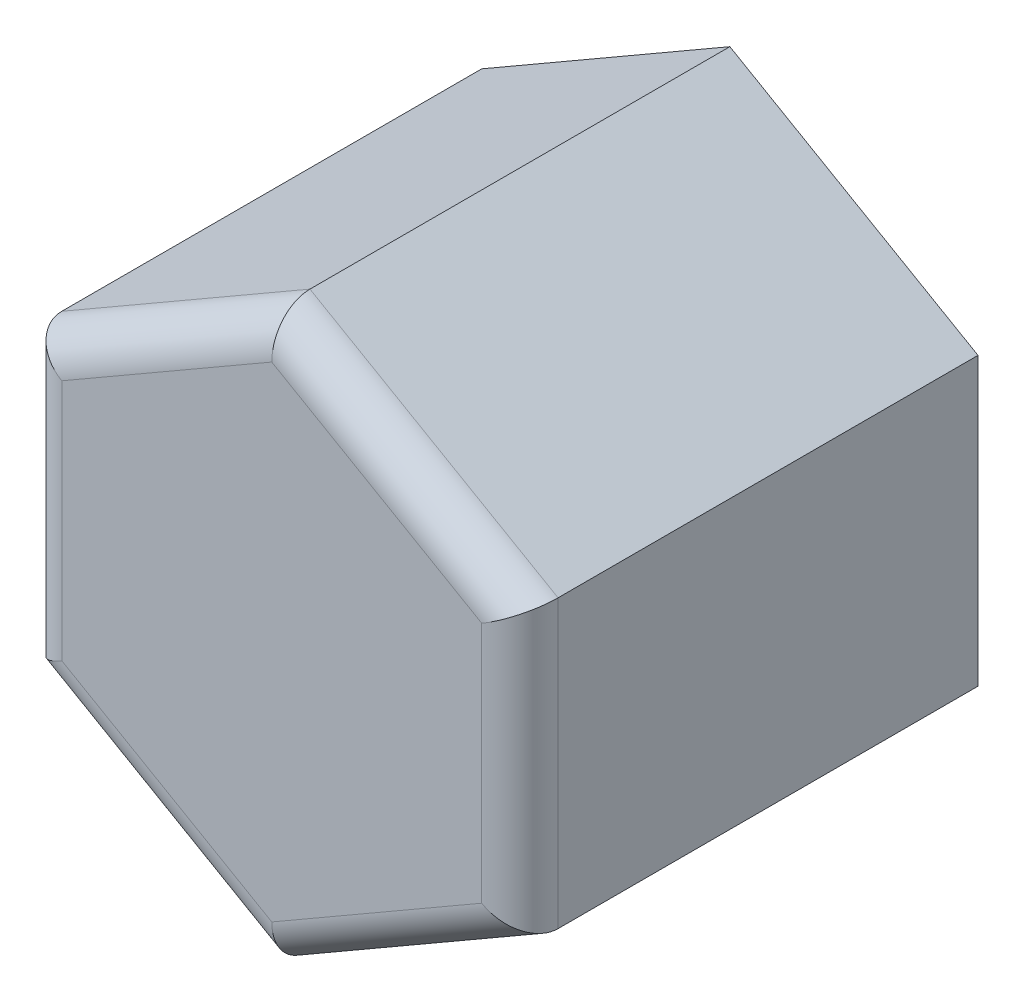
from build123d import *

# Parameters (mm, degrees)
EXTRUDE_276_DEPTH     = 6
SKETCH_3_R            = 4
CUT_EXTRUDE_451_DEPTH = 9.7
THREAD_2_PITCH        = 1.25
FILLET_1_R            = 1


with BuildPart() as part:
    # Эскиз1 → Extrude 276 (new, symmetric)
    with BuildSketch(Plane.XY):
        Polygon((0, 7.505553499), (-6.5, 3.75277675), (-6.5, -3.75277675), (0, -7.505553499), (6.5, -3.75277675), (6.5, 3.75277675), align=None)
    extrude(amount=EXTRUDE_276_DEPTH, both=True)

    # Эскиз3 → Cut-Extrude 451 (cut)
    with BuildSketch(Plane(origin=(0, 0, -6), x_dir=(-1, 0, 0), z_dir=(0, 0, -1))):
        Circle(SKETCH_3_R)
    extrude(amount=-CUT_EXTRUDE_451_DEPTH, mode=Mode.SUBTRACT)

    # Резьба2: the profile of Профиль резьбы2 profile screwed along a right-hand helix of 7.76 turns, 8 arcs to a turn; built about Z, then put on its axis
    thread_2_z = Axis((0, 0, 0), (0, 0, 1))
    thread_2_corners = [(4.0003, 0, -0.000173205), (3.323417656, 0, 0.390624998), (3.323417656, 0, 0.546874998), (4.0003, 0, 0.937673202)]
    with BuildLine(mode=Mode.PRIVATE) as thread_2_profile:
        Line(thread_2_corners[0], thread_2_corners[1])
        Line(thread_2_corners[1], thread_2_corners[2])
        Line(thread_2_corners[2], thread_2_corners[3])
        Line(thread_2_corners[3], thread_2_corners[0])
    thread_2_cap = Face(thread_2_profile.wire())
    thread_2_turn_angles = [0, 22.5, 45, 67.5, 90, 112.5, 135, 157.5, 180, 202.5, 225, 247.5, 270, 292.5, 315, 337.5, 360]
    thread_2_turn_weights = [1, 0.9238795325112867, 1, 0.9238795325112867, 1, 0.9238795325112867, 1, 0.9238795325112867, 1, 0.9238795325112867, 1, 0.9238795325112867, 1, 0.9238795325112867, 1, 0.9238795325112867, 1]
    thread_2_turn_rails = [Edge.make_bspline([Vector(p[0], p[1], 0).rotate(thread_2_z, thread_2_turn_angles[k]) / thread_2_turn_weights[k] + Vector(0, 0, p[2] + THREAD_2_PITCH * thread_2_turn_angles[k] / 360) for k in range(17)], [0, 0, 0, 1, 1, 2, 2, 3, 3, 4, 4, 5, 5, 6, 6, 7, 7, 8, 8, 8], 2, thread_2_turn_weights) for p in thread_2_corners]
    thread_2_turn_sides = [Face.make_surface_from_curves(thread_2_turn_rails[p[0]], thread_2_turn_rails[p[1]]) for p in [(0, 1), (1, 2), (2, 3), (3, 0)]]
    thread_2_last_angles = [2520, 2542.5, 2565, 2587.5, 2610, 2632.5, 2655, 2677.5, 2700, 2722.5, 2745, 2767.5, 2790, 2791.8, 2793.6]
    thread_2_last_weights = [1, 0.9238795325112867, 1, 0.9238795325112867, 1, 0.9238795325112867, 1, 0.9238795325112867, 1, 0.9238795325112867, 1, 0.9238795325112867, 1, 0.9995065603657317, 1]
    thread_2_last_rails = [Edge.make_bspline([Vector(p[0], p[1], 0).rotate(thread_2_z, thread_2_last_angles[k]) / thread_2_last_weights[k] + Vector(0, 0, p[2] + THREAD_2_PITCH * thread_2_last_angles[k] / 360) for k in range(15)], [0, 0, 0, 1, 1, 2, 2, 3, 3, 4, 4, 5, 5, 6, 6, 7, 7, 7], 2, thread_2_last_weights) for p in thread_2_corners]
    thread_2_last_sides = [Face.make_surface_from_curves(thread_2_last_rails[p[0]], thread_2_last_rails[p[1]]) for p in [(0, 1), (1, 2), (2, 3), (3, 0)]]
    thread_2 = Plane(origin=(0, 0, -6), x_dir=(1, 0, 0), z_dir=(0, 0, 1)) * Solid(Shell([*[p.moved(Location((0, 0, THREAD_2_PITCH * i))) for i in range(7) for p in thread_2_turn_sides], *thread_2_last_sides, thread_2_cap, thread_2_cap.rotate(thread_2_z, 2793.6).moved(Location((0, 0, THREAD_2_PITCH * 2793.6 / 360)))]))
    add(thread_2)

    # Скругление1
    fillet_1_edges = [part.edges().sort_by_distance(p)[0] for p in [
        (-6.5, 0, 6),
        (-3.25, -5.629165125, 6),
        (3.25, -5.629165125, 6),
        (6.5, 0, 6),
        (3.25, 5.629165125, 6),
        (-3.25, 5.629165125, 6),
    ]]
    fillet(fillet_1_edges, radius=FILLET_1_R)


solid = part.part
